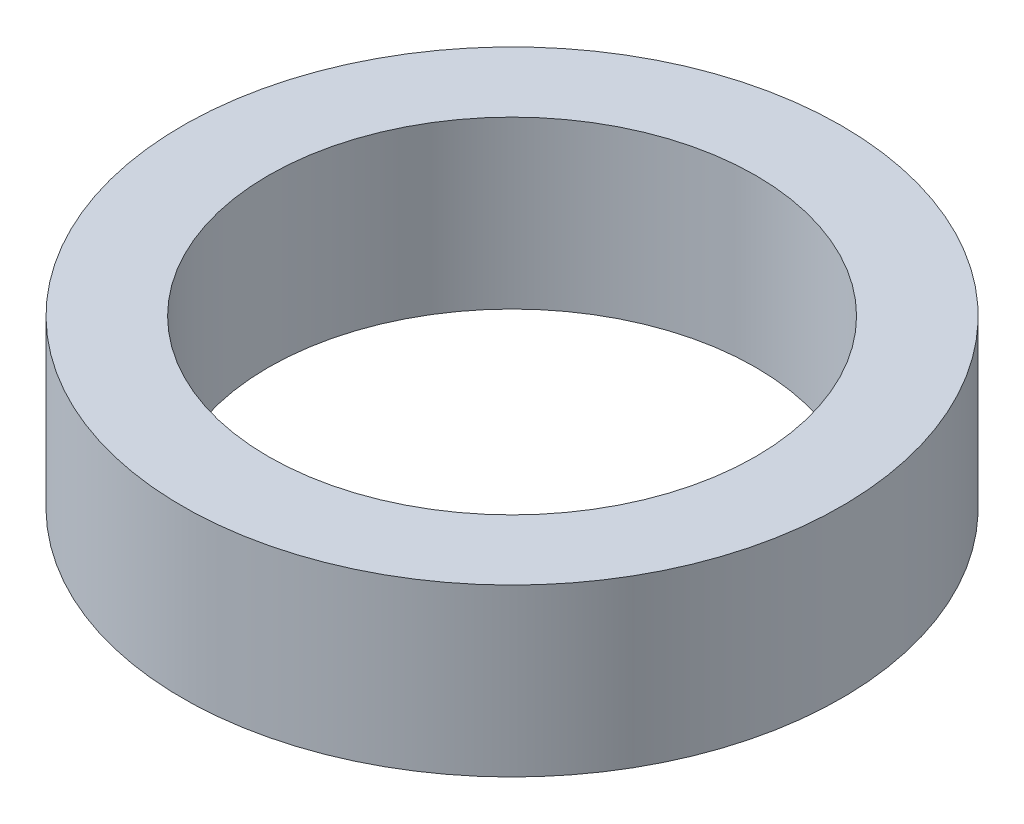
from build123d import *

# Parameters (mm, degrees)
SKETCH1_R           = 57.5
BOSS_EXTRUDE1_DEPTH = 29
SKETCH2_R           = 42.5
CUT_EXTRUDE1_DEPTH  = 87.333655083


with BuildPart() as part:
    # Sketch1 → Boss-Extrude1 (new body)
    with BuildSketch(Plane(origin=(0, 0, 0), x_dir=(1, 0, 0), z_dir=(0, 1, 0))):
        Circle(SKETCH1_R)
    extrude(amount=BOSS_EXTRUDE1_DEPTH)

    # Sketch2 → Cut-Extrude1 (cut, through all)
    with BuildSketch(Plane(origin=(0, 0, 0), x_dir=(1, 0, 0), z_dir=(0, 1, 0))):
        Circle(SKETCH2_R)
    extrude(amount=CUT_EXTRUDE1_DEPTH, mode=Mode.SUBTRACT)


solid = part.part
